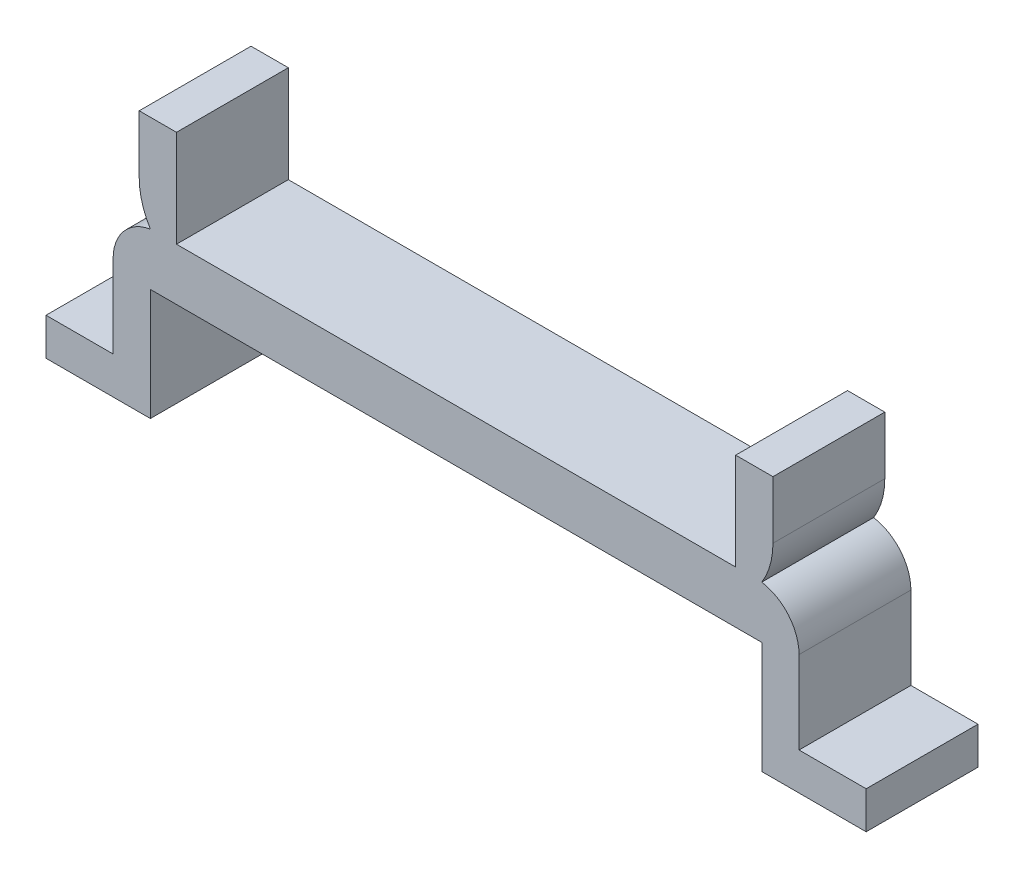
from build123d import *

# Parameters (mm, degrees)
SKETCH1_W           = 82
SKETCH1_H           = 15
BOSS_EXTRUDE1_DEPTH = 7
SKETCH3_W           = 5
SKETCH3_H           = 15
BOSS_EXTRUDE2_DEPTH = 13
FILLET1_R           = 10
SKETCH4_W           = 5
SKETCH4_H           = 22
BOSS_EXTRUDE3_DEPTH = 15
FILLET2_R           = 6
SKETCH5_W           = 15
SKETCH5_H           = 5
BOSS_EXTRUDE4_DEPTH = 9


with BuildPart() as part:
    # Sketch1 → Boss-Extrude1 (new body)
    with BuildSketch(Plane(origin=(0, 0, 0), x_dir=(1, 0, 0), z_dir=(0, 1, 0))):
        Rectangle(SKETCH1_W, SKETCH1_H)
    extrude(amount=BOSS_EXTRUDE1_DEPTH)

    # Sketch3 → Boss-Extrude2 (add)
    with BuildSketch(Plane(origin=(0, 7, 0), x_dir=(1, 0, 0), z_dir=(0, 1, 0))):
        with Locations((-40, 0)):
            Rectangle(SKETCH3_W, SKETCH3_H)
        with Locations((40, 0)):
            Rectangle(SKETCH3_W, SKETCH3_H)
    extrude(amount=BOSS_EXTRUDE2_DEPTH)

    # Fillet1
    # the kernel refuses this fillet: 10 mm, written as the material it takes off along each edge
    with BuildSketch(Plane(origin=(42.5, 7, -20.669567191), x_dir=(-1, 0, 0), z_dir=(0, 0, 1)), Plane(origin=(-42.5, 7, 20.669567191), x_dir=(1, 0, 0), z_dir=(0, 0, -1))) as fillet1_piece_1:
        with BuildLine():
            CenterArc((10, -5.267826876), FILLET1_R, 148.211669383, 31.788330617)
            Line((0, -5.267826876), (-0.2, -5.267826876))
            Line((-0.2, -5.267826876), (-0.2, 0))
            Line((-0.2, 0), (0, 0.2))
            ThreePointArc((0, 0.2), (0.75, 0.2), (1.33, 0.105356538))
            Line((1.33, 0.105356538), (1.5, 0))
        make_face()
    extrude(amount=41.339134382, mode=Mode.SUBTRACT)

    # Sketch4 → Boss-Extrude3 (add)
    with BuildSketch(Plane(origin=(0, 0, -7.5), x_dir=(-1, 0, 0), z_dir=(0, 0, -1))):
        with Locations((-43.5, -4)):
            Rectangle(SKETCH4_W, SKETCH4_H)
        with Locations((43.5, -4)):
            Rectangle(SKETCH4_W, SKETCH4_H)
    extrude(amount=-BOSS_EXTRUDE3_DEPTH)

    # Fillet2
    # the kernel refuses this fillet: 6 mm, written as the material it takes off along each edge
    with BuildSketch(Plane(origin=(46, 7, -22.290199458), x_dir=(-1, 0, 0), z_dir=(0, 0, 1))) as fillet2_piece_1_section:
        with BuildLine():
            CenterArc((6, 5.916079783), FILLET2_R, 180, 80.405931773)
            Line((0, 5.916079783), (-0.12, 5.916079783))
            Line((-0.12, 5.916079783), (-0.12, 0))
            Line((-0.12, 0), (0, -0.12))
            ThreePointArc((0, -0.12), (2.5, -0.12), (4.98, -0.118321596))
            Line((4.98, -0.118321596), (5, 0))
        make_face()
    fillet2_piece_1 = extrude(amount=44.580398916, mode=Mode.PRIVATE)
    fillet2_piece_1 = fillet2_piece_1 - Plane(origin=(32.5, 12.267826876, 0), x_dir=(-1, 0, 0), z_dir=(0, 0, -1)) * Cylinder(10, 113, mode=Mode.PRIVATE)
    add(fillet2_piece_1, mode=Mode.SUBTRACT)
    with BuildSketch(Plane(origin=(-46, 7, -22.290199458), x_dir=(1, 0, 0), z_dir=(0, 0, 1))) as fillet2_piece_2_section:
        with BuildLine():
            CenterArc((6, -5.916079783), FILLET2_R, 99.594068227, 80.405931773)
            Line((0, -5.916079783), (-0.12, -5.916079783))
            Line((-0.12, -5.916079783), (-0.12, 0))
            Line((-0.12, 0), (0, 0.12))
            ThreePointArc((0, 0.12), (2.5, 0.12), (4.98, 0.118321596))
            Line((4.98, 0.118321596), (5, 0))
        make_face()
    fillet2_piece_2 = extrude(amount=44.580398916, mode=Mode.PRIVATE)
    fillet2_piece_2 = fillet2_piece_2 - Plane(origin=(-32.5, 12.267826876, 0), x_dir=(1, 0, 0), z_dir=(0, 0, 1)) * Cylinder(10, 113, mode=Mode.PRIVATE)
    add(fillet2_piece_2, mode=Mode.SUBTRACT)

    # Sketch5 → Boss-Extrude4 (add)
    with BuildSketch(Plane.ZY.offset(46)):
        with Locations((0, -12.5)):
            Rectangle(SKETCH5_W, SKETCH5_H)
    boss_extrude4 = extrude(amount=BOSS_EXTRUDE4_DEPTH)

    # Mirror1: Boss-Extrude4 across plane
    add(boss_extrude4.mirror(Plane(origin=(0, 0, 0), x_dir=(0, 0, 1), z_dir=(1, 0, 0))))


solid = part.part
